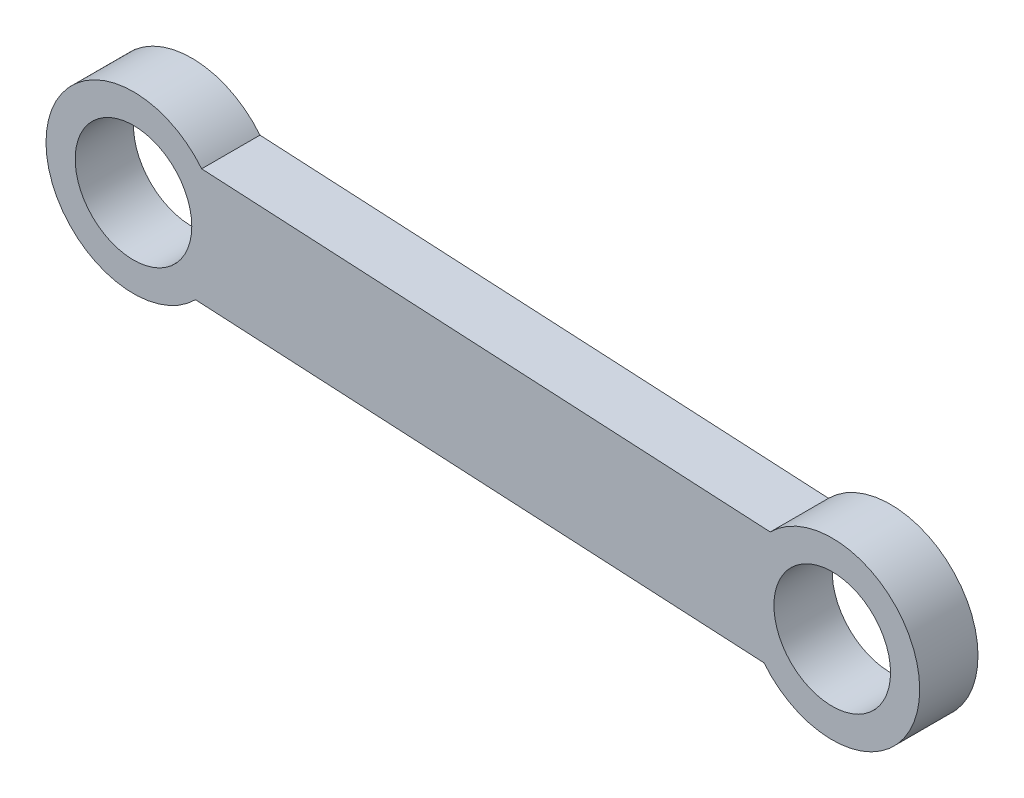
from build123d import *

# Parameters (mm, degrees)
SKETCH1_R           = 5
BOSS_EXTRUDE1_DEPTH = 5


with BuildPart() as part:
    # Sketch1 → Boss-Extrude1 (new body)
    with BuildSketch(Plane(origin=(0, 0, 0), x_dir=(0.4311817754230788, 0.9022650810837144, 0), z_dir=(0, 0, 1))):
        with BuildLine():
            Line((-20.794099729, 35.342372963), (-39.476574827, 80.445857725))
            ThreePointArc((-39.476574827, 80.445857725), (-49.105363654, 90.626180651), (-48.715370152, 76.619023401))
            Line((-48.715370152, 76.619023401), (-30.032895054, 31.515538639))
            ThreePointArc((-30.032895054, 31.515538639), (-20.404106227, 21.335215713), (-20.794099729, 35.342372963))
        make_face()
        with Locations((-23.27423197, 28.264312207)):
            Circle(SKETCH1_R, mode=Mode.SUBTRACT)
        with Locations((-46.235237911, 83.697084158)):
            Circle(SKETCH1_R, mode=Mode.SUBTRACT)
    extrude(amount=BOSS_EXTRUDE1_DEPTH)


solid = part.part
